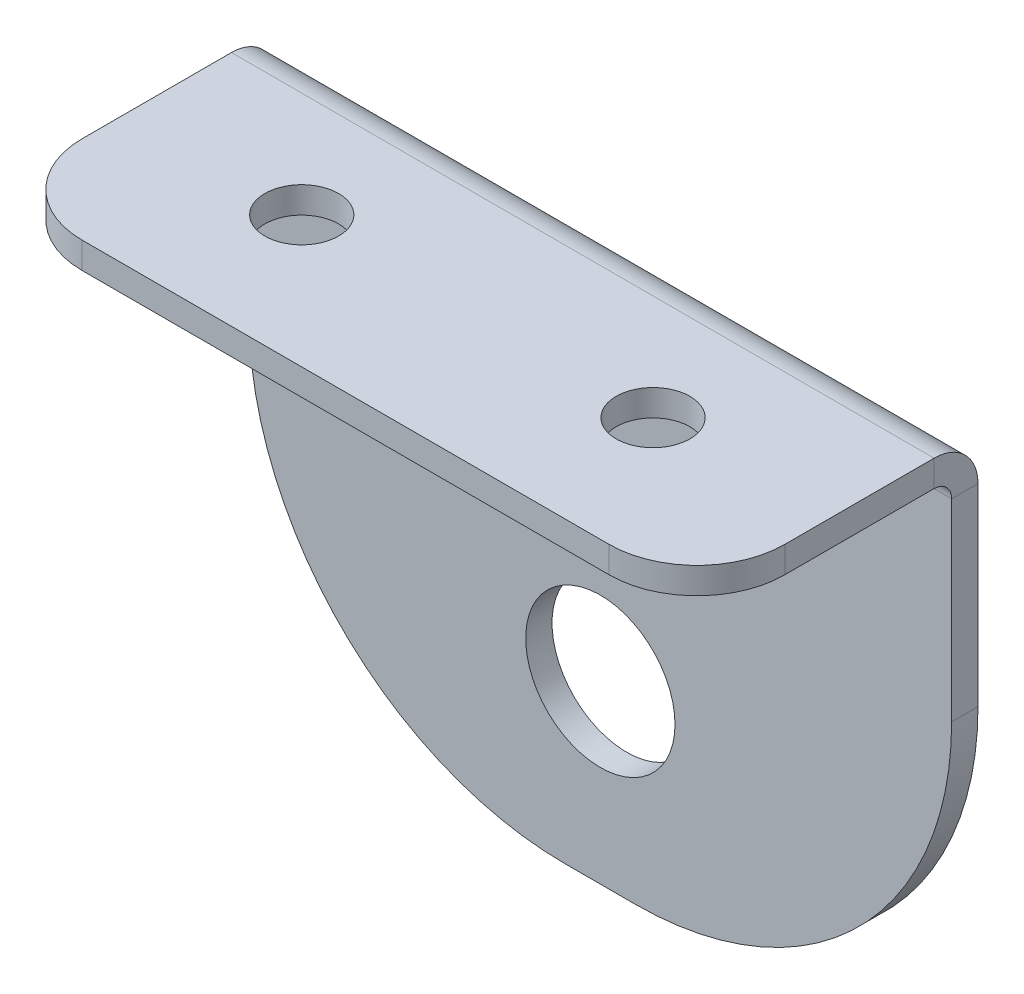
from build123d import *

# Parameters (mm, degrees)
SKETCH_1_R                       = 4.25
SM_BASE_FLANGE_1_DEPTH           = 1.5
SM_EDGE_FLANGE_1_STRIP_W         = 8
SM_EDGE_FLANGE_1_STRIP_H         = 1.5
SM_EDGE_FLANGE_1_STRIP_CUT_DEPTH = 40
SM_EDGE_FLANGE_1_DEPTH           = 40
SM_EDGE_FLANGE_1_PROFILE_R       = 2.1
SM_EDGE_FLANGE_1_FLAT_DEPTH      = 1.5


# Sheet-metal steps are written as plain solids
with BuildPart() as part:
    # Sketch 1 → 基体-法兰1 (new body)
    with BuildSketch(Plane.XY):
        with BuildLine():
            Line((-20, 21.5), (20, 21.5))
            Line((20, 21.5), (20, 8))
            ThreePointArc((20, 8), (14.727922061, -4.727922061), (2, -10))
            Line((2, -10), (-2, -10))
            ThreePointArc((-2, -10), (-14.727922061, -4.727922061), (-20, 8))
            Line((-20, 8), (-20, 21.5))
        make_face()
        Circle(SKETCH_1_R, mode=Mode.SUBTRACT)
    extrude(amount=-SM_BASE_FLANGE_1_DEPTH)

    # 边线-法兰1 strip (across the edge) → 边线-法兰1 strip cut (cut)
    with BuildSketch(Plane(origin=(20, 21.5, 0), x_dir=(0, -1, 0), z_dir=(-1, 0, 0))):
        with Locations((-1.5, -0.75)):
            Rectangle(SM_EDGE_FLANGE_1_STRIP_W, SM_EDGE_FLANGE_1_STRIP_H)
    extrude(amount=SM_EDGE_FLANGE_1_STRIP_CUT_DEPTH, mode=Mode.SUBTRACT)

    # 边线-法兰1 bend section (across the edge) → 边线-法兰1 (add)
    with BuildSketch(Plane(origin=(20, 21.5, 0), x_dir=(0, -1, 0), z_dir=(-1, 0, 0))):
        with BuildLine():
            Line((0, 1), (1.5, 1))
            ThreePointArc((1.5, 1), (1.792893219, 0.292893219), (2.5, 0))
            Line((2.5, 0), (2.5, -1.5))
            ThreePointArc((2.5, -1.5), (0.732233047, -0.767766953), (0, 1))
        make_face()
    extrude(amount=SM_EDGE_FLANGE_1_DEPTH)

    # 边线-法兰1 profile (on flange) → 边线-法兰1 flat (add)
    with BuildSketch(Plane(origin=(0, 21.5, 0), x_dir=(-1, 0, 0), z_dir=(0, 1, 0))):
        with BuildLine():
            Line((15, 14.5), (-15, 14.5))
            ThreePointArc((-15, 14.5), (-18.535533906, 13.035533906), (-20, 9.5))
            Line((-20, 9.5), (-20, 1))
            Line((-20, 1), (20, 1))
            Line((20, 1), (20, 9.5))
            ThreePointArc((20, 9.5), (18.535533906, 13.035533906), (15, 14.5))
        make_face()
        with Locations((-10, 7)):
            Circle(SM_EDGE_FLANGE_1_PROFILE_R, mode=Mode.SUBTRACT)
        with Locations((10, 7)):
            Circle(SM_EDGE_FLANGE_1_PROFILE_R, mode=Mode.SUBTRACT)
    extrude(amount=-SM_EDGE_FLANGE_1_FLAT_DEPTH)


solid = part.part
